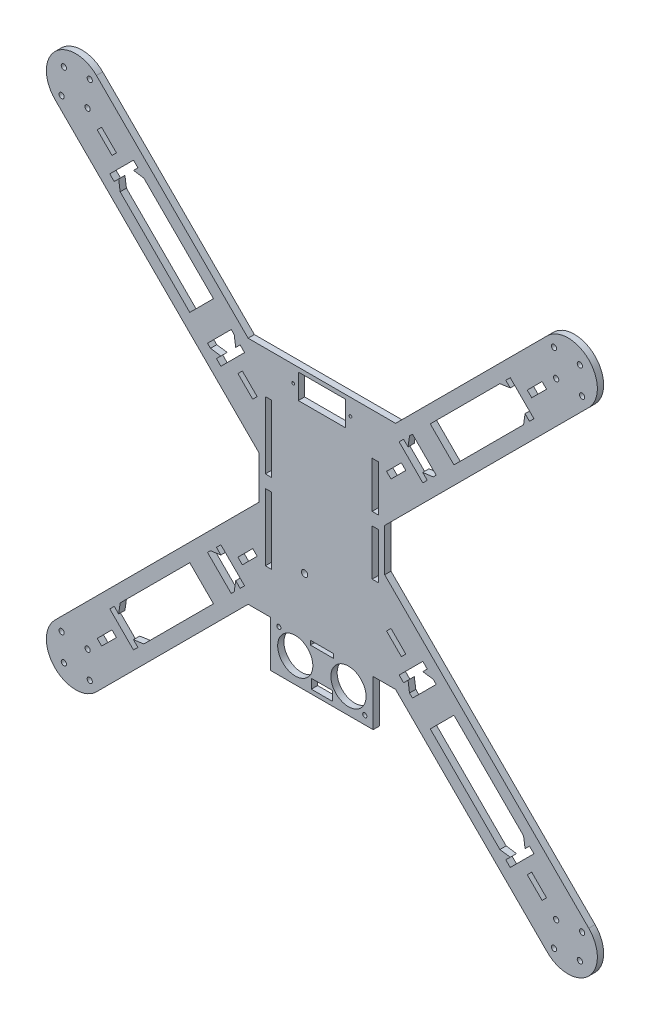
from build123d import *

# Parameters (mm, degrees)
BOSS_EXTRUDE1_DEPTH = 3
SKETCH4_R           = 1.25
CUT_EXTRUDE1_DEPTH  = 3
SKETCH5_R           = 0.65
SKETCH5_W           = 22.5
SKETCH5_H           = 11.8
CUT_EXTRUDE2_DEPTH  = 3
SKETCH6_R           = 1.5
CUT_EXTRUDE3_DEPTH  = 3
SKETCH7_R           = 1
SKETCH7_R_2         = 8.4
SKETCH7_W           = 11
SKETCH7_H           = 2
SKETCH7_W_2         = 10
SKETCH7_H_2         = 4.5
CUT_EXTRUDE4_DEPTH  = 3
CUT_EXTRUDE5_DEPTH  = 186.993279448
BOSS_EXTRUDE2_REACH = 195.992
SKETCH9_W           = 3
SKETCH9_H           = 12
BOSS_EXTRUDE3_REACH = 195.992
SKETCH11_W          = 3
SKETCH11_H          = 12
BOSS_EXTRUDE4_REACH = 195.992
SKETCH12_W          = 3
SKETCH12_H          = 12
BOSS_EXTRUDE5_REACH = 195.992
SKETCH13_W          = 3
SKETCH13_H          = 12
SKETCH14_W          = 3
SKETCH14_H          = 32
SKETCH14_H_2        = 22
CUT_EXTRUDE6_DEPTH  = 186.993279448


with BuildPart() as part:
    # Sketch1 → Boss-Extrude1 (new body)
    with BuildSketch(Plane.XY):
        with BuildLine():
            Line((35.201010127, 55), (-35.201010127, 55))
            Line((-35.201010127, 55), (-107.600505063, 127.399494937))
            ThreePointArc((-107.600505063, 127.399494937), (-127.399494937, 127.399494937), (-127.399494937, 107.600505063))
            Line((-127.399494937, 107.600505063), (-30, 10.201010127))
            Line((-30, 10.201010127), (-30, -10.201010127))
            Line((-30, -10.201010127), (-127.399494937, -107.600505063))
            ThreePointArc((-127.399494937, -107.600505063), (-127.399494937, -127.399494937), (-107.600505063, -127.399494937))
            Line((-107.600505063, -127.399494937), (-35.201010127, -55))
            Line((-35.201010127, -55), (-24.5, -55))
            Line((-24.5, -55), (-24.5, -77))
            Line((-24.5, -77), (24.5, -77))
            Line((24.5, -77), (24.5, -55))
            Line((24.5, -55), (35.201010127, -55))
            Line((35.201010127, -55), (107.600505063, -127.399494937))
            ThreePointArc((107.600505063, -127.399494937), (127.399494937, -127.399494937), (127.399494937, -107.600505063))
            Line((127.399494937, -107.600505063), (30, -10.201010127))
            Line((30, -10.201010127), (30, 10.201010127))
            Line((30, 10.201010127), (127.399494937, 107.600505063))
            ThreePointArc((127.399494937, 107.600505063), (127.399494937, 127.399494937), (107.600505063, 127.399494937))
            Line((107.600505063, 127.399494937), (35.201010127, 55))
        make_face()
    extrude(amount=-BOSS_EXTRUDE1_DEPTH)

    # Sketch4 → Cut-Extrude1 (cut)
    with BuildSketch(Plane.XY):
        with Locations((-110.782485579, 124.217514421)):
            Circle(SKETCH4_R)
        with Locations((-124.217514421, 110.782485579)):
            Circle(SKETCH4_R)
        with Locations((-123.156854249, 123.156854249)):
            Circle(SKETCH4_R)
        with Locations((-111.843145751, 111.843145751)):
            Circle(SKETCH4_R)
        with Locations((111.843145751, 111.843145751)):
            Circle(SKETCH4_R)
        with Locations((110.782485579, 124.217514421)):
            Circle(SKETCH4_R)
        with Locations((123.156854249, 123.15685425)):
            Circle(SKETCH4_R)
        with Locations((124.217514421, 110.782485579)):
            Circle(SKETCH4_R)
        with Locations((111.843145751, -111.84314575)):
            Circle(SKETCH4_R)
        with Locations((124.217514421, -110.782485579)):
            Circle(SKETCH4_R)
        with Locations((123.15685425, -123.156854249)):
            Circle(SKETCH4_R)
        with Locations((110.782485579, -124.217514421)):
            Circle(SKETCH4_R)
        with Locations((-111.84314575, -111.843145751)):
            Circle(SKETCH4_R)
        with Locations((-110.782485579, -124.217514421)):
            Circle(SKETCH4_R)
        with Locations((-123.156854249, -123.156854249)):
            Circle(SKETCH4_R)
        with Locations((-124.217514421, -110.782485579)):
            Circle(SKETCH4_R)
    extrude(amount=-CUT_EXTRUDE1_DEPTH, mode=Mode.SUBTRACT)

    # Sketch5 → Cut-Extrude2 (cut)
    with BuildSketch(Plane.XY):
        with Locations((-13.65, 47.1)):
            Circle(SKETCH5_R)
        with Locations((13.65, 47.1)):
            Circle(SKETCH5_R)
        with Locations((0, 47.1)):
            Rectangle(SKETCH5_W, SKETCH5_H)
    extrude(amount=-CUT_EXTRUDE2_DEPTH, mode=Mode.SUBTRACT)

    # Sketch6 → Cut-Extrude3 (cut)
    with BuildSketch(Plane.XY):
        with Locations((-8.25, -28.8)):
            Circle(SKETCH6_R)
    extrude(amount=-CUT_EXTRUDE3_DEPTH, mode=Mode.SUBTRACT)

    # Sketch7 → Cut-Extrude4 (cut)
    with BuildSketch(Plane.XY):
        with Locations((-20.5, -57)):
            Circle(SKETCH7_R)
        with Locations((-12.7, -65)):
            Circle(SKETCH7_R_2)
        with Locations((12.7, -65)):
            Circle(SKETCH7_R_2)
        with Locations((20.5, -73)):
            Circle(SKETCH7_R)
        with Locations((0, -56)):
            Rectangle(SKETCH7_W, SKETCH7_H)
        with Locations((0, -72.75)):
            Rectangle(SKETCH7_W_2, SKETCH7_H_2)
    extrude(amount=-CUT_EXTRUDE4_DEPTH, mode=Mode.SUBTRACT)

    # Sketch8 → Cut-Extrude5 (cut, through all)
    with BuildSketch(Plane.XY):
        Polygon((101.236544033, -89.922835534), (89.922835534, -101.236544033), (87.80151519, -99.115223689), (89.922835534, -96.993903346), (84.973088065, -96.286796564), (41.839574413, -53.153282912), (41.132467632, -48.203535444), (39.011147288, -50.324855787), (36.889826945, -48.203535444), (48.203535444, -36.889826945), (50.324855787, -39.011147288), (48.203535444, -41.132467632), (53.153282912, -41.839574413), (96.286796564, -84.973088065), (96.993903346, -89.922835534), (99.115223689, -87.80151519), align=None)
        Polygon((40.07180746, -37.950487117), (37.950487117, -40.07180746), (30.879419305, -33.000739648), (33.000739648, -30.879419305), align=None)
        Polygon((50.324855787, 39.011147288), (48.203535444, 36.889826945), (36.889826945, 48.203535444), (39.011147288, 50.324855787), (41.132467632, 48.203535444), (41.839574413, 53.153282912), (84.973088065, 96.286796564), (89.922835534, 96.993903346), (87.80151519, 99.115223689), (89.922835534, 101.236544033), (101.236544033, 89.922835534), (99.115223689, 87.80151519), (96.993903346, 89.922835534), (96.286796564, 84.973088065), (53.153282912, 41.839574413), (48.142875272, 41.193127804), align=None)
        Polygon((100.175883861, -98.054563517), (98.054563517, -100.175883861), (105.125631329, -107.246951673), (107.246951673, -105.125631329), align=None)
        Polygon((-101.236544033, -89.922835534), (-99.115223689, -87.80151519), (-96.993903346, -89.922835534), (-96.286796564, -84.973088065), (-53.153282912, -41.839574413), (-48.203535444, -41.132467632), (-50.324855787, -39.011147288), (-48.203535444, -36.889826945), (-36.889826945, -48.203535444), (-39.011147288, -50.324855787), (-41.132467632, -48.203535444), (-41.839574413, -53.153282912), (-84.973088065, -96.286796564), (-89.922835534, -96.993903346), (-87.80151519, -99.115223689), (-89.922835534, -101.236544033), align=None)
        Polygon((-100.175883861, -98.054563517), (-107.246951673, -105.125631329), (-105.125631329, -107.246951673), (-98.054563517, -100.175883861), align=None)
        Polygon((-37.950487117, -40.07180746), (-40.07180746, -37.950487117), (-33.000739648, -30.879419305), (-30.879419305, -33.000739648), align=None)
        Polygon((-89.922835534, 101.236544033), (-87.80151519, 99.115223689), (-89.922835534, 96.993903346), (-84.973088065, 96.286796564), (-41.839574413, 53.153282912), (-41.132467632, 48.203535444), (-39.011147288, 50.324855787), (-36.889826945, 48.203535444), (-48.203535444, 36.889826945), (-50.324855787, 39.011147288), (-48.203535444, 41.132467632), (-53.153282912, 41.839574413), (-96.286796564, 84.973088065), (-96.993903346, 89.922835534), (-99.115223689, 87.80151519), (-101.236544033, 89.922835534), align=None)
        Polygon((-98.054563517, 100.175883861), (-105.125631329, 107.246951673), (-107.246951673, 105.125631329), (-100.175883861, 98.054563517), align=None)
        Polygon((-40.07180746, 37.950487117), (-37.950487117, 40.07180746), (-30.879419305, 33.000739648), (-33.000739648, 30.879419305), align=None)
        Polygon((100.175883861, 98.054563517), (107.246951673, 105.125631329), (105.125631329, 107.246951673), (98.054563517, 100.175883861), align=None)
        Polygon((37.950487117, 40.07180746), (40.07180746, 37.950487117), (33.000739648, 30.879419305), (30.879419305, 33.000739648), align=None)
    extrude(amount=-CUT_EXTRUDE5_DEPTH, mode=Mode.SUBTRACT)

    # Sketch9 → Boss-Extrude2 (add, up to next)
    with BuildSketch(Plane(origin=(-5.656854249, 5.656854249, 0), x_dir=(0, 0, -1), z_dir=(0.70710678118654, -0.707106781186555, 0)), mode=Mode.PRIVATE) as boss_extrude2_sk1:
        with Locations((1.5, 75.170093579)):
            Rectangle(SKETCH9_W, SKETCH9_H)
    boss_extrude2_tool1 = extrude(boss_extrude2_sk1.sketch, amount=BOSS_EXTRUDE2_REACH, mode=Mode.PRIVATE) - part.part
    add(boss_extrude2_tool1.solids().sort_by_distance((47.496429, 58.810137, -1.5))[0])

    # Sketch11 → Boss-Extrude3 (add, up to next)
    with BuildSketch(Plane(origin=(5.656854249, 5.656854249, 0), x_dir=(0, 0, 1), z_dir=(-0.7071067811865477, -0.7071067811865475, 0)), mode=Mode.PRIVATE) as boss_extrude3_sk1:
        with Locations((-1.5, -75.170093579)):
            Rectangle(SKETCH11_W, SKETCH11_H)
    boss_extrude3_tool1 = extrude(boss_extrude3_sk1.sketch, amount=BOSS_EXTRUDE3_REACH, mode=Mode.PRIVATE) - part.part
    add(boss_extrude3_tool1.solids().sort_by_distance((58.810137, -47.496429, -1.5))[0])

    # Sketch12 → Boss-Extrude4 (add, up to next)
    with BuildSketch(Plane(origin=(5.656854249, -5.656854249, 0), x_dir=(0, 0, 1), z_dir=(-0.7071067811865449, 0.7071067811865502, 0)), mode=Mode.PRIVATE) as boss_extrude4_sk1:
        with Locations((-1.5, -75.170093579)):
            Rectangle(SKETCH12_W, SKETCH12_H)
    boss_extrude4_tool1 = extrude(boss_extrude4_sk1.sketch, amount=BOSS_EXTRUDE4_REACH, mode=Mode.PRIVATE) - part.part
    add(boss_extrude4_tool1.solids().sort_by_distance((-47.496429, -58.810137, -1.5))[0])

    # Sketch13 → Boss-Extrude5 (add, up to next)
    with BuildSketch(Plane(origin=(5.656854249, 5.656854249, 0), x_dir=(0, 0, 1), z_dir=(-0.707106781186552, -0.707106781186543, 0)), mode=Mode.PRIVATE) as boss_extrude5_sk1:
        with Locations((-1.5, 75.170093579)):
            Rectangle(SKETCH13_W, SKETCH13_H)
    boss_extrude5_tool1 = extrude(boss_extrude5_sk1.sketch, amount=BOSS_EXTRUDE5_REACH, mode=Mode.PRIVATE) - part.part
    add(boss_extrude5_tool1.solids().sort_by_distance((-47.496429, 58.810137, -1.5))[0])

    # Sketch14 → Cut-Extrude6 (cut, through all)
    with BuildSketch(Plane(origin=(0, 0, -3), x_dir=(-1, 0, 0), z_dir=(0, 0, -1))):
        with Locations((25.5, -19)):
            Rectangle(SKETCH14_W, SKETCH14_H)
        with Locations((25.5, 19)):
            Rectangle(SKETCH14_W, SKETCH14_H)
        with Locations((-25.5, -4)):
            Rectangle(SKETCH14_W, SKETCH14_H_2)
        with Locations((-25.5, 24)):
            Rectangle(SKETCH14_W, SKETCH14_H_2)
    extrude(amount=-CUT_EXTRUDE6_DEPTH, mode=Mode.SUBTRACT)


solid = part.part
